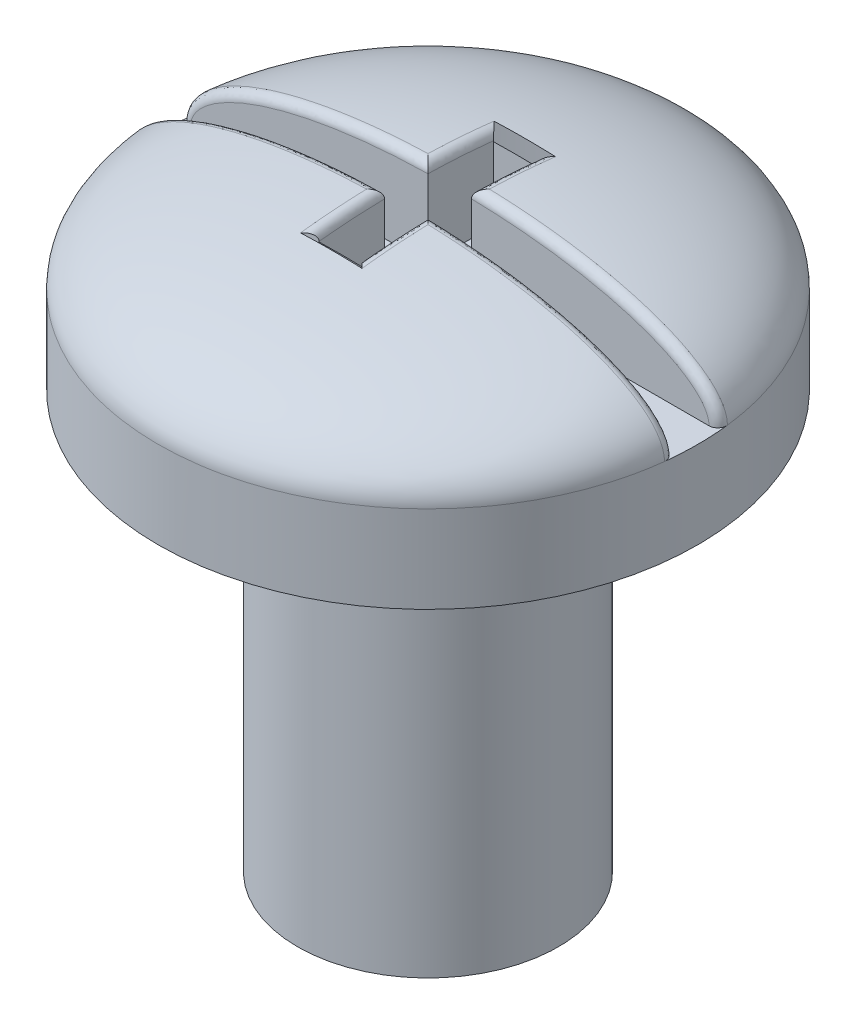
from build123d import *

# Parameters (mm, degrees)
SKETCH1_R           = 3.1
BOSS_EXTRUDE1_DEPTH = 0.9
SKETCH3_R           = 3.1
BOSS_EXTRUDE2_DEPTH = 1.1
FILLET1_SIZE        = 1
FILLET1_SIZE_2      = 3
CUT_EXTRUDE1_DEPTH  = 1
FILLET2_R           = 0.1
SKETCH5_R           = 1.5
BOSS_EXTRUDE3_DEPTH = 4.8


with BuildPart() as part:
    # Sketch1 → Boss-Extrude1 (new body)
    with BuildSketch(Plane(origin=(0, 0, 0), x_dir=(1, 0, 0), z_dir=(0, 1, 0))):
        with Locations(Location((0, 0, 0), (0, 0, 270))):
            Circle(SKETCH1_R)
    extrude(amount=BOSS_EXTRUDE1_DEPTH)

    # Sketch3 → Boss-Extrude2 (add)
    with BuildSketch(Plane(origin=(0, 0.9, 0), x_dir=(1, 0, 0), z_dir=(0, 1, 0))):
        with Locations(Location((0, 0, 0), (0, 0, 270))):
            Circle(SKETCH3_R)
    extrude(amount=BOSS_EXTRUDE2_DEPTH)

    # Fillet1
    # an asymmetric fillet: 3, 1 mm, written as the material it takes off along each edge
    with BuildSketch(Plane(origin=(0, 2, 0), x_dir=(0, 0, 1), z_dir=(-1, 0, 0))) as fillet1_piece_1:
        with BuildLine():
            Bezier((3.1, -FILLET1_SIZE), (3.1, 0), (3.1 - FILLET1_SIZE_2, 0), weights=[1, 0.707106781, 1])
            Line((3.1 - FILLET1_SIZE_2, 0), (3.1, 0))
            Line((3.1, 0), (3.1, -FILLET1_SIZE))
        make_face()
    revolve(axis=Axis((0, 2, 0), (0, 1, 0)), mode=Mode.SUBTRACT)

    # Sketch4 → Cut-Extrude1 (cut)
    with BuildSketch(Plane(origin=(0, 2, 0), x_dir=(1, 0, 0), z_dir=(0, 1, 0))):
        Polygon((-3.5, -0.25), (-0.25, -0.25), (-0.25, -1), (0.25, -1), (0.25, -0.25), (3.5, -0.25), (3.5, 0.25), (0.25, 0.25), (0.25, 1), (-0.25, 1), (-0.25, 0.25), (-3.5, 0.25), align=None)
    extrude(amount=-CUT_EXTRUDE1_DEPTH, mode=Mode.SUBTRACT)

    # Fillet2
    fillet2_edges = [part.edges().sort_by_distance(p)[0] for p in [
        (0.25, 1.981550935, -0.625492086),
        (-0.25, 1.981550935, 0.625492086),
        (1.82660223, 1.813753339, -0.25),
        (1.82660223, 1.813753339, 0.25),
        (0.25, 1.981550935, 0.625492086),
        (-1.82660223, 1.813753339, 0.25),
        (-1.82660223, 1.813753348, -0.25),
        (-0.25, 1.981550935, -0.625492086),
        (-0.125010839, 1.953119382, 1),
        (0, 1.953939201, -1),
    ]]
    fillet(fillet2_edges, radius=FILLET2_R)

    # Sketch5 → Boss-Extrude3 (add)
    with BuildSketch(Plane.XZ):
        with Locations(Location((0, 0, 0), (0, 0, 270))):
            Circle(SKETCH5_R)
    extrude(amount=BOSS_EXTRUDE3_DEPTH)


solid = part.part
